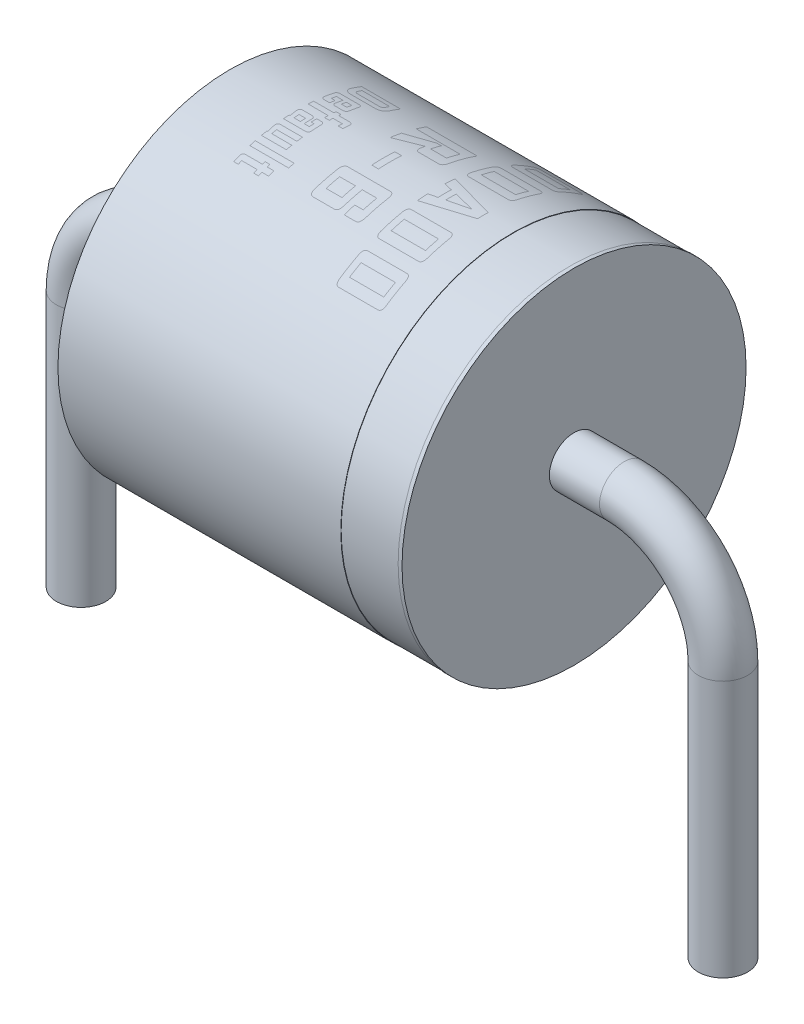
from build123d import *

# Parameters (mm, degrees)
SKETCH1_R     = 4.425
BODY_DEPTH    = 4.425
CATHODE_START = 0.1
SKETCH8_R     = 4.435
SKETCH8_R_2   = 4.415
CATHODE_DEPTH = 1.475
SKETCH6_R     = 0.635


with BuildPart() as part:
    # Sketch1 → BODY (new, symmetric)
    with BuildSketch(Plane(origin=(8.255, 0, 0), x_dir=(0, 0, -1), z_dir=(1, 0, 0))):
        with Locations((0, 6.425)):
            Circle(SKETCH1_R)
    extrude(amount=BODY_DEPTH, both=True)

    # Sketch8 → CATHODE (cut)
    with BuildSketch(Plane.ZY.offset(-12.68).offset(CATHODE_START)):
        with Locations((0, 6.425)):
            Circle(SKETCH8_R)
        with Locations((0, 6.425)):
            Circle(SKETCH8_R_2, mode=Mode.SUBTRACT)
    extrude(amount=CATHODE_DEPTH, mode=Mode.SUBTRACT)

    # PINS: sweep along a path in Sketch7
    with BuildLine(Plane.XY) as pins_path:
        Line((0, -2.6), (0, 4.01))
        ThreePointArc((0, 4.01), (0.743948776, 5.806051224), (2.54, 6.55))
        Line((2.54, 6.55), (13.97, 6.55))
        ThreePointArc((13.97, 6.55), (15.766051224, 5.806051224), (16.51, 4.01))
        Line((16.51, 4.01), (16.51, -2.6))
    # Sketch6 → PINS (sweep)
    with BuildSketch(Plane(origin=(8.255, 0, 0), x_dir=(0, 0, -1), z_dir=(1, 0, 0))):
        with Locations((0, 6.55)):
            Circle(SKETCH6_R)
    sweep(path=pins_path.line)


solid = part.part
